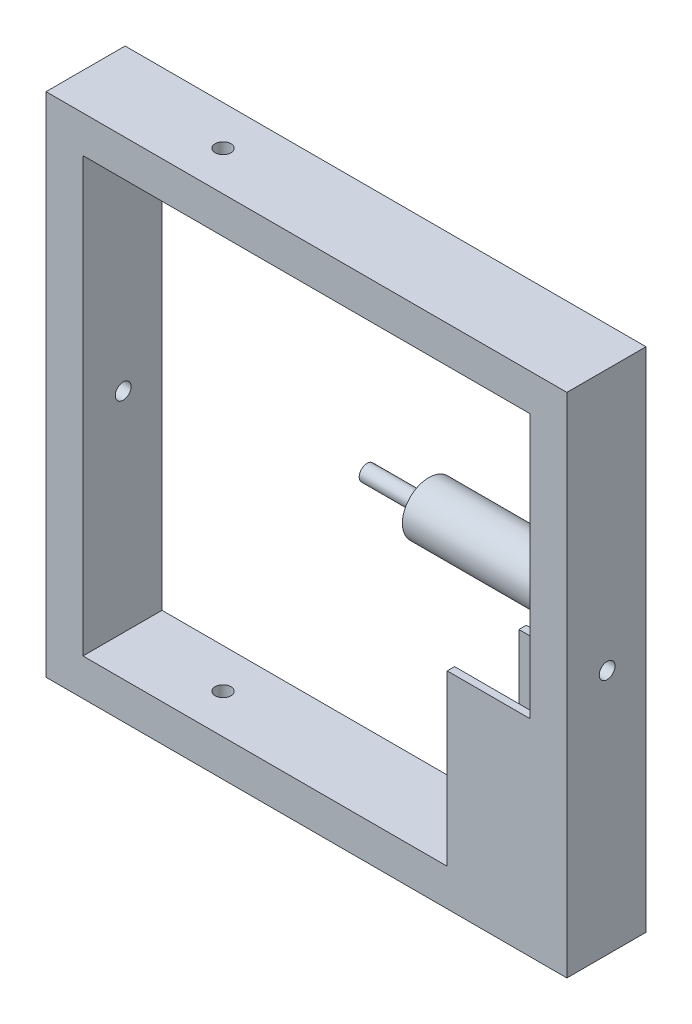
from build123d import *

# Parameters (mm, degrees)
SKETCH_1_W               = 98.8
SKETCH_1_H               = 96.2
EXTRUDE_2_DEPTH          = 15
CUT_EXTRUDE_1_DEPTH      = 43
CUT_EXTRUDE_1_DEPTH_BACK = 57
SKETCH_4_W               = 84.8
SKETCH_4_H               = 82.2
SKETCH_10_W              = 15
SKETCH_10_H              = 32.1
EXTRUDE_4_DEPTH          = 16
SKETCH_11_W              = 12.2
SKETCH_11_H              = 28.2
CUT_EXTRUDE_2_DEPTH      = 9
SKETCH_12_R              = 5.011519167
EXTRUDE_5_DEPTH          = 26.7
SKETCH_13_R              = 1.5
EXTRUDE_6_DEPTH          = 11.7
SKETCH_14_W              = 15
SKETCH_14_H              = 3.984812986
EXTRUDE_7_DEPTH          = 6.7
FILLET_1_R               = 10
SKETCH_15_W              = 1.4
SKETCH_15_H              = 28.115187014
EXTRUDE_8_DEPTH          = 6.7
SKETCH_17_W              = 1.4
SKETCH_17_H              = 28.115187014
EXTRUDE_9_DEPTH          = 6.7
CUT_EXTRUDE_3_DEPTH      = 128
CUT_EXTRUDE_3_DEPTH_BACK = 32.7
SKETCH_18_R              = 1.5
CUT_EXTRUDE_4_DEPTH      = 107
CUT_EXTRUDE_4_DEPTH_BACK = 39.7
SKETCH_19_R              = 1.5


with BuildPart() as part:
    # Эскиз1 → Бобышка-Вытянуть2 (new body)
    with BuildSketch(Plane.XY):
        with Locations((49.4, -48.1)):
            Rectangle(SKETCH_1_W, SKETCH_1_H)
    extrude(amount=EXTRUDE_2_DEPTH)

    # Эскиз4 → Вырез-Вытянуть1 (cut, two sides: drawn at the far end of the back side and taken through both)
    with BuildSketch(Plane.XY.offset(15).offset(-CUT_EXTRUDE_1_DEPTH_BACK)):
        with Locations((49.4, -48.1)):
            Rectangle(SKETCH_4_W, SKETCH_4_H)
    extrude(amount=CUT_EXTRUDE_1_DEPTH + CUT_EXTRUDE_1_DEPTH_BACK, mode=Mode.SUBTRACT)

    # Эскиз10 → Бобышка-Вытянуть4 (add)
    with BuildSketch(Plane(origin=(98.8, 0, 0), x_dir=(0, 0, -1), z_dir=(1, 0, 0))):
        with Locations((-7.5, -73.15)):
            Rectangle(SKETCH_10_W, SKETCH_10_H)
    extrude(amount=-EXTRUDE_4_DEPTH)

    # Эскиз11 → Вырез-Вытянуть2 (cut)
    with BuildSketch(Plane.ZY.offset(-82.8)):
        with Locations((7.5, -71.1)):
            Rectangle(SKETCH_11_W, SKETCH_11_H)
    extrude(amount=-CUT_EXTRUDE_2_DEPTH, mode=Mode.SUBTRACT)

    # Эскиз12 → Бобышка-Вытянуть5 (add)
    with BuildSketch(Plane.ZY.offset(-91.8)):
        with Locations((7.5, -39.6)):
            Circle(SKETCH_12_R)
    extrude(amount=EXTRUDE_5_DEPTH)

    # Эскиз13 → Бобышка-Вытянуть6 (add)
    with BuildSketch(Plane.ZY.offset(-65.1)):
        with Locations((7.5, -39.6)):
            Circle(SKETCH_13_R)
    extrude(amount=EXTRUDE_6_DEPTH)

    # Эскиз14 → Бобышка-Вытянуть7 (add)
    with BuildSketch(Plane.ZY.offset(-82.8)):
        with Locations((7.5, -87.207593507)):
            Rectangle(SKETCH_14_W, SKETCH_14_H)
    extrude(amount=EXTRUDE_7_DEPTH)

    # Скругление1
    # the kernel refuses this fillet: 10 mm, written as the material it takes off along each edge
    with BuildSketch(Plane(origin=(82.8, -85.2, 13.6), x_dir=(0, -1, 0), z_dir=(0, 0, -1))) as fillet_1_piece_1:
        with BuildLine():
            CenterArc((10, -0.550917082), FILLET_1_R, 176.841878722, 3.158121278)
            Line((0, -0.550917082), (0, 0))
            Line((0, 0), (0.015187014, 0))
        make_face()
    extrude(amount=12.2, mode=Mode.SUBTRACT)

    # Эскиз15 → Бобышка-Вытянуть8 (add)
    with BuildSketch(Plane.ZY.offset(-82.8)):
        with Locations((0.7, -71.157593507)):
            Rectangle(SKETCH_15_W, SKETCH_15_H)
    extrude(amount=EXTRUDE_8_DEPTH)

    # Эскиз17 → Бобышка-Вытянуть9 (add)
    with BuildSketch(Plane.ZY.offset(-82.8)):
        with Locations((14.3, -71.157593507)):
            Rectangle(SKETCH_17_W, SKETCH_17_H)
    extrude(amount=EXTRUDE_9_DEPTH)

    # Эскиз18 → Вырез-Вытянуть3 (cut, two sides: drawn at the far end of the back side and taken through both)
    with BuildSketch(Plane(origin=(7, 0, 0), x_dir=(0, 0, -1), z_dir=(1, 0, 0)).offset(-CUT_EXTRUDE_3_DEPTH_BACK)):
        with Locations(Location((-7.365603058, -49.501812711, 0), (0, 0, 180))):
            Circle(SKETCH_18_R)
    extrude(amount=CUT_EXTRUDE_3_DEPTH + CUT_EXTRUDE_3_DEPTH_BACK, mode=Mode.SUBTRACT)

    # Эскиз19 → Вырез-Вытянуть4 (cut, two sides: drawn at the far end of the back side and taken through both)
    with BuildSketch(Plane(origin=(0, -89.2, 0), x_dir=(1, 0, 0), z_dir=(0, 1, 0)).offset(-CUT_EXTRUDE_4_DEPTH_BACK)):
        with Locations((26.080914384, -7.5)):
            Circle(SKETCH_19_R)
    extrude(amount=CUT_EXTRUDE_4_DEPTH + CUT_EXTRUDE_4_DEPTH_BACK, mode=Mode.SUBTRACT)


solid = part.part
